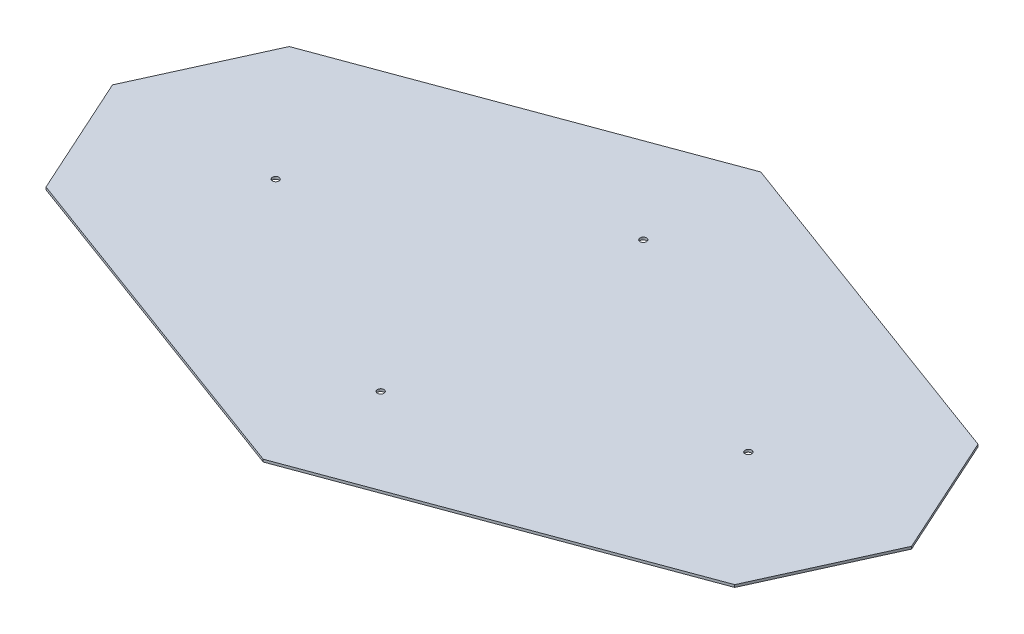
from build123d import *

# Parameters (mm, degrees)
BOSS_EXTRUDE1_DEPTH   = 1.190625
SKETCH2_R             = 3.175
CUT_EXTRUDE1_DEPTH    = 456.240158496
CRVPATTERN1_START     = -1.190625
CRVPATTERN1_OUTLINE_R = 3.175
CRVPATTERN1_DEPTH     = 2.38125


# Read off the part's stored shape, not the designer's step: CrvPattern1
with BuildPart() as part:
    # Sketch1 → Boss-Extrude1 (new, symmetric)
    with BuildSketch(Plane(origin=(0, 0, 0), x_dir=(1, 0, 0), z_dir=(0, 1, 0))):
        Polygon((-333.074526413, 117.648642651), (0, 240.597926469), (333.074526413, 117.648642651), (386.459013784, 0), (333.074526413, -117.648642651), (0, -240.597926469), (-333.074526413, -117.648642651), (-386.459013784, 0), align=None)
    extrude(amount=BOSS_EXTRUDE1_DEPTH, both=True)

    # Sketch2 → Cut-Extrude1 (cut, through all)
    with BuildSketch(Plane(origin=(0, 1.190625, 0), x_dir=(1, 0, 0), z_dir=(0, 1, 0))):
        with Locations(Location((0, 127, 0), (0, 0, 270))):
            Circle(SKETCH2_R)
    extrude(amount=-CUT_EXTRUDE1_DEPTH, mode=Mode.SUBTRACT)

    # CrvPattern1 outline → CrvPattern1 (cut)
    with BuildSketch(Plane(origin=(0, 0, 0), x_dir=(1, 0, 0), z_dir=(0, 1, 0)).offset(CRVPATTERN1_START)):
        with Locations((-228.6, 0)):
            Circle(CRVPATTERN1_OUTLINE_R)
        with Locations((0, -127)):
            Circle(CRVPATTERN1_OUTLINE_R)
        with Locations((228.6, 0)):
            Circle(CRVPATTERN1_OUTLINE_R)
    extrude(amount=CRVPATTERN1_DEPTH, mode=Mode.SUBTRACT)


solid = part.part
